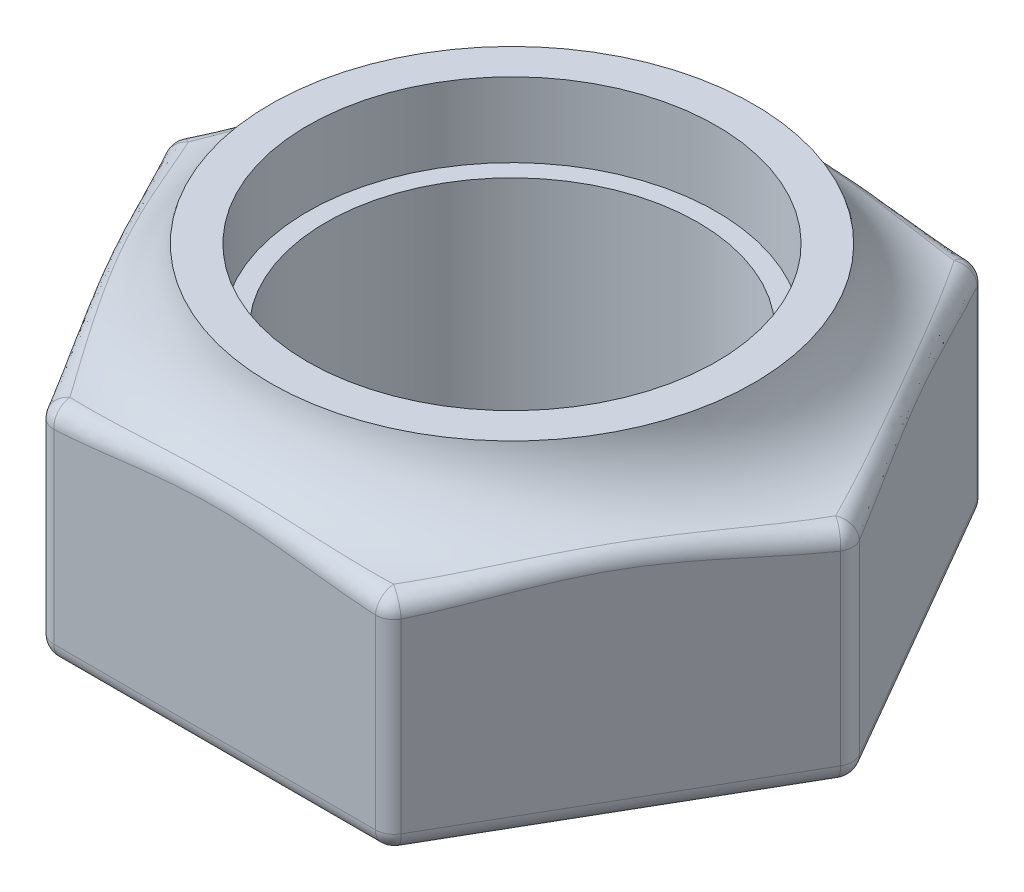
from build123d import *

# Parameters (mm, degrees)
BOSS_EXTRUDE1_DEPTH = 3
SKETCH2_R           = 3.25
SKETCH2_R_2         = 2.75
BOSS_EXTRUDE2_DEPTH = 1
FILLET2_R           = 1.27
SKETCH3_R           = 2.5
CUT_EXTRUDE1_DEPTH  = 7.806859456
FILLET3_R           = 0.254


with BuildPart() as part:
    # Sketch1 → Boss-Extrude1 (new body)
    with BuildSketch(Plane(origin=(0, 0, 0), x_dir=(1, 0, 0), z_dir=(0, 1, 0))):
        Polygon((4.618802154, 0), (2.309401077, 4), (-2.309401077, 4), (-4.618802154, 0), (-2.309401077, -4), (2.309401077, -4), align=None)
    extrude(amount=BOSS_EXTRUDE1_DEPTH)

    # Sketch2 → Boss-Extrude2 (add)
    with BuildSketch(Plane(origin=(0, 3, 0), x_dir=(1, 0, 0), z_dir=(0, 1, 0))):
        with Locations(Location((0, 0, 0), (0, 0, 270))):
            Circle(SKETCH2_R)
        with Locations(Location((0, 0, 0), (0, 0, 270))):
            Circle(SKETCH2_R_2, mode=Mode.SUBTRACT)
    extrude(amount=BOSS_EXTRUDE2_DEPTH)

    # Fillet2
    # the kernel refuses this fillet: 1.27 mm, written as the material it adds along each edge
    with BuildSketch(Plane(origin=(0, 3, 0), x_dir=(0, 0, 1), z_dir=(-1, 0, 0))) as fillet2_piece_1_section:
        with BuildLine():
            CenterArc((4.490967365, 1.27), FILLET2_R, 192.274670215, 77.725329785)
            Line((3.25, 1), (3.25, 0))
            Line((3.25, 0), (4.490967365, 0))
        make_face()
    fillet2_piece_1 = revolve(axis=Axis((0, 3, 0), (0, 1, 0)), mode=Mode.PRIVATE)
    fillet2_piece_1 = split(fillet2_piece_1, bisect_by=Plane(origin=(3.464101615, 3, -2), z_dir=(-0.8660254037844382, 0, 0.500000000000001)), keep=Keep.TOP, mode=Mode.PRIVATE)
    fillet2_piece_1 = split(fillet2_piece_1, bisect_by=Plane(origin=(3.464101615, 3, 2), z_dir=(-0.8660254037844416, 0, -0.4999999999999949)), keep=Keep.TOP, mode=Mode.PRIVATE)
    fillet2_piece_1 = split(fillet2_piece_1, bisect_by=Plane(origin=(0, 3, -4), z_dir=(0, 0, 1)), keep=Keep.TOP, mode=Mode.PRIVATE)
    fillet2_piece_1 = split(fillet2_piece_1, bisect_by=Plane(origin=(0, 3, 4), z_dir=(0, 0, -1)), keep=Keep.TOP, mode=Mode.PRIVATE)
    fillet2_piece_1 = split(fillet2_piece_1, bisect_by=Plane(origin=(-3.464101615, 3, -2), z_dir=(0.8660254037844416, 0, 0.499999999999995)), keep=Keep.TOP, mode=Mode.PRIVATE)
    fillet2_piece_1 = split(fillet2_piece_1, bisect_by=Plane(origin=(-3.464101615, 3, 2), z_dir=(0.8660254037844346, 0, -0.5000000000000071)), keep=Keep.TOP, mode=Mode.PRIVATE)
    add(fillet2_piece_1)

    # Sketch3 → Cut-Extrude1 (cut, through all)
    with BuildSketch(Plane(origin=(0, 3, 0), x_dir=(1, 0, 0), z_dir=(0, 1, 0))):
        with Locations(Location((0, 0, 0), (0, 0, 270))):
            Circle(SKETCH3_R)
    extrude(amount=-CUT_EXTRUDE1_DEPTH, mode=Mode.SUBTRACT)

    # Fillet3
    fillet3_edges = [part.edges().sort_by_distance(p)[0] for p in [
        (-3.464101615, 3.098739548, -2),
        (-3.464101615, 0, -2),
        (-4.618802154, 1.5, 0),
        (-3.464101615, 3.098739548, 2),
        (-3.464101615, 0, 2),
        (-2.309401077, 1.5, 4),
        (-1.021048577, 3.052895152, 4),
        (0, 0, 4),
        (2.309401077, 1.5, 4),
        (3.464101615, 3.098739548, 2),
        (3.464101615, 0, 2),
        (4.618802154, 1.5, 0),
        (3.464101615, 3.098739548, -2),
        (3.464101615, 0, -2),
        (2.309401077, 1.5, -4),
        (0, 3.098739548, -4),
        (-2.309401077, 1.5, -4),
        (0, 0, -4),
    ]]
    fillet(fillet3_edges, radius=FILLET3_R)


solid = part.part
